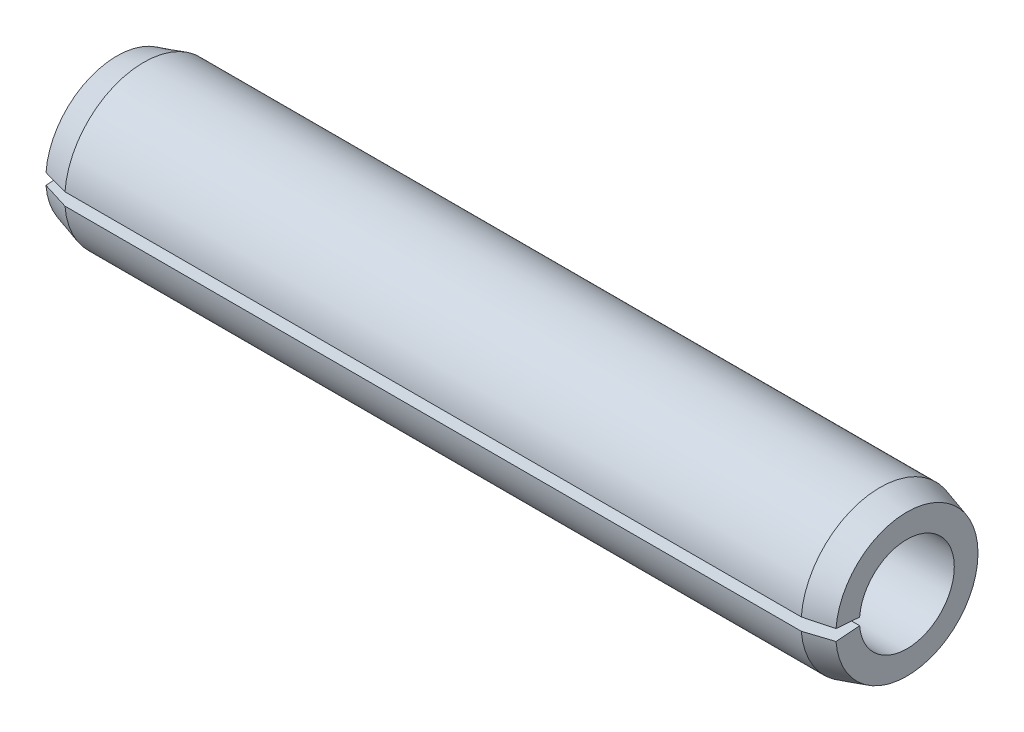
from build123d import *

# Parameters (mm, degrees)
GAP_DEPTH = 101.995049384


with BuildPart() as part:
    # Sketch1 → Base-Revolve (revolve)
    with BuildSketch(Plane.XY):
        Polygon((0, 6), (100, 6), (100, 9), (96.6, 10), (3.4, 10), (0, 9), align=None)
    revolve(axis=Axis((-9.525, 0, 0), (1, 0, 0)))

    # Sketch2 → Gap (cut, through all)
    with BuildSketch(Plane(origin=(0, 0, 0), x_dir=(0, -1, 0), z_dir=(-1, 0, 0))):
        with BuildLine():
            Line((0, 0), (0.800282776, 10.168556804))
            ThreePointArc((0.800282776, 10.168556804), (0, 10.2), (-0.800282776, 10.168556804))
            Line((-0.800282776, 10.168556804), (0, 0))
        make_face()
    extrude(amount=-GAP_DEPTH, mode=Mode.SUBTRACT)


solid = part.part
